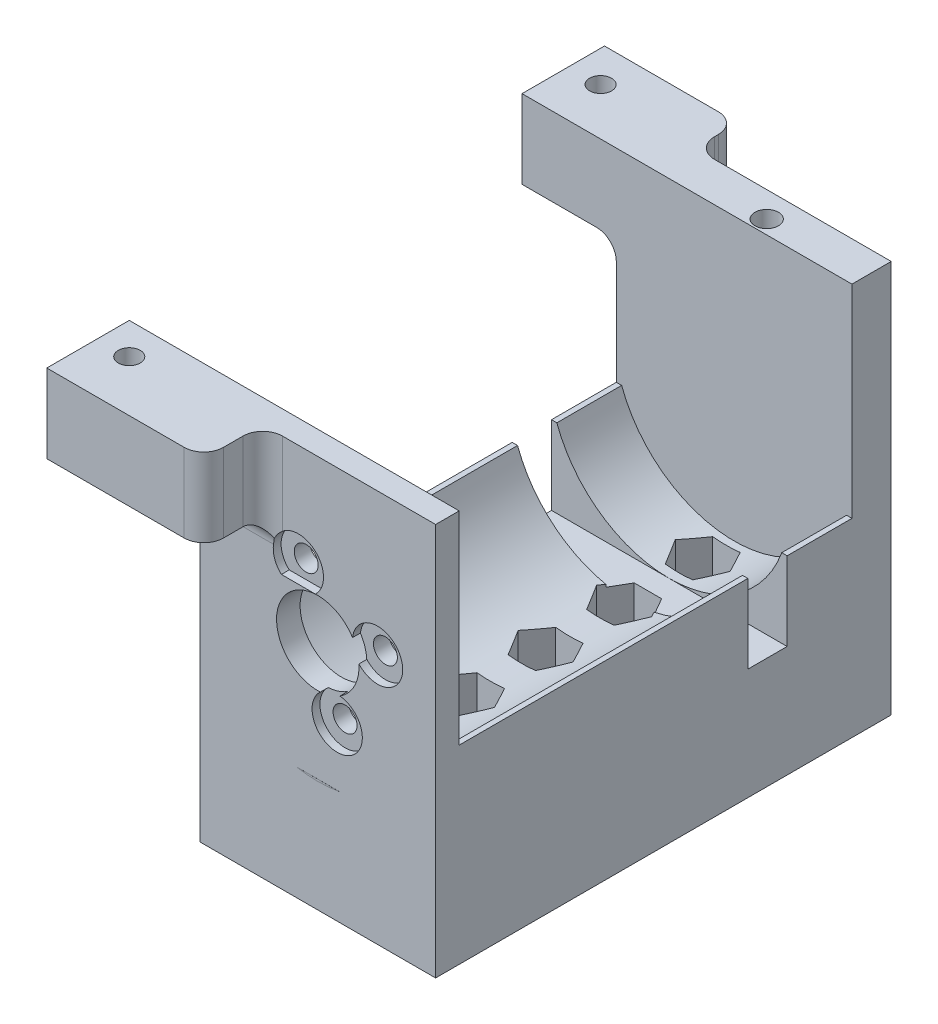
from build123d import *

# Parameters (mm, degrees)
SKETCH1_R            = 1.525
BOSS_EXTRUDE1_DEPTH  = 3
BOSS_EXTRUDE2_DEPTH  = 53
SKETCH3_R            = 1.55
CUT_EXTRUDE1_DEPTH   = 68.267232922
BOSS_EXTRUDE3_DEPTH  = 3
SKETCH7_W            = 30
SKETCH7_H            = 50
BOSS_EXTRUDE4_DEPTH  = 5
SKETCH9_W            = 5
SKETCH9_H            = 20
CUT_EXTRUDE6_DEPTH   = 70.215826448
SKETCH11_R           = 1.4
BOSS_EXTRUDE5_DEPTH  = 10
SKETCH12_R           = 1.5
CUT_EXTRUDE8_DEPTH   = 10
CUT_EXTRUDE2_START   = -5
SKETCH5_R            = 1.55
CUT_EXTRUDE2_DEPTH   = 79.00150601
SKETCH6_R            = 3.2
CUT_EXTRUDE3_DEPTH   = 1
BOSS_EXTRUDE8_REACH  = 85.002
SKETCH17_R           = 1.4
BOSS_EXTRUDE10_START = -3
BOSS_EXTRUDE10_DEPTH = 3
SKETCH20_W           = 22.007484123
SKETCH20_H           = 3
BOSS_EXTRUDE11_DEPTH = 7.575
FILLET3_R            = 2.5
FILLET2_R            = 2.5


with BuildPart() as part:
    # Sketch1 → Boss-Extrude1 (new body)
    with BuildSketch(Plane.XY):
        with BuildLine():
            Line((-15, -15), (15, -15))
            Line((15, -15), (15, 13))
            Line((15, 13), (-15, 13))
            Line((-15, 13), (-15, 5.25))
            Line((-15, 5.25), (0, 5.25))
            ThreePointArc((0, 5.25), (3.712310601, 3.712310601), (5.25, 0))
            ThreePointArc((5.25, 0), (3.712310601, -3.712310601), (0, -5.25))
            Line((0, -5.25), (-15, -5.25))
            Line((-15, -5.25), (-15, -15))
        make_face()
        with Locations((-2.472135955, 7.60845213)):
            Circle(SKETCH1_R, mode=Mode.SUBTRACT)
        with Locations((7.60845213, 2.472135955)):
            Circle(SKETCH1_R, mode=Mode.SUBTRACT)
        with Locations((2.472135955, -7.60845213)):
            Circle(SKETCH1_R, mode=Mode.SUBTRACT)
    extrude(amount=BOSS_EXTRUDE1_DEPTH)

    # Sketch2 → Boss-Extrude2 (add)
    with BuildSketch(Plane.XY.offset(3)):
        with BuildLine():
            Line((-15, -15), (-15, -5.25))
            Line((-15, -5.25), (-14.317821063, -5.25))
            ThreePointArc((-14.317821063, -5.25), (0, -15.25), (14.317821063, -5.25))
            Line((14.317821063, -5.25), (15, -5.25))
            Line((15, -5.25), (15, -15))
            Line((15, -15), (15, -29.425))
            Line((15, -29.425), (-15, -29.425))
            Line((-15, -29.425), (-15, -15))
        make_face()
    extrude(amount=-BOSS_EXTRUDE2_DEPTH)

    # Sketch3 → Cut-Extrude1 (cut, through all)
    with BuildSketch(Plane(origin=(0, -29.425, 0), x_dir=(-1, 0, 0), z_dir=(0, -1, 0))):
        with Locations(Location((0, 46, 0), (0, 0, 90))):
            Circle(SKETCH3_R)
        with Locations(Location((0, 36, 0), (0, 0, 90))):
            Circle(SKETCH3_R)
        with Locations(Location((0, 26, 0), (0, 0, 90))):
            Circle(SKETCH3_R)
        with Locations(Location((0, 16, 0), (0, 0, 90))):
            Circle(SKETCH3_R)
        with Locations(Location((0, 6, 0), (0, 0, 90))):
            Circle(SKETCH3_R)
    extrude(amount=-CUT_EXTRUDE1_DEPTH, mode=Mode.SUBTRACT)

    # Sketch7 → Boss-Extrude4 (add)
    with BuildSketch(Plane(origin=(0, 0, -50), x_dir=(-1, 0, 0), z_dir=(0, 0, -1))):
        with Locations((0, -4.425)):
            Rectangle(SKETCH7_W, SKETCH7_H)
    extrude(amount=BOSS_EXTRUDE4_DEPTH)

    # Sketch9 → Cut-Extrude6 (cut, through all)
    with BuildSketch(Plane.ZY.offset(15)):
        with Locations((-39.25, -5.25)):
            Rectangle(SKETCH9_W, SKETCH9_H)
    extrude(amount=-CUT_EXTRUDE6_DEPTH, mode=Mode.SUBTRACT)

    # Sketch11 → Boss-Extrude5 (add)
    with BuildSketch(Plane(origin=(0, 20.575, 0), x_dir=(1, 0, 0), z_dir=(0, 1, 0))):
        Polygon((-15, 50), (-27, 50), (-27, 60.5), (-10, 60.5), (-10, 55), (-15, 55), align=None)
        with Locations(Location((-23, 56, 0), (0, 0, 270))):
            Circle(SKETCH11_R, mode=Mode.SUBTRACT)
    extrude(amount=-BOSS_EXTRUDE5_DEPTH)

    # Sketch12 → Cut-Extrude8 (cut)
    with BuildSketch(Plane(origin=(0, 20.575, 0), x_dir=(1, 0, 0), z_dir=(0, 1, 0))):
        with Locations(Location((2.4, 51.75, 0), (0, 0, 270))):
            Circle(SKETCH12_R)
    extrude(amount=-CUT_EXTRUDE8_DEPTH, mode=Mode.SUBTRACT)

    # Sketch5 → Cut-Extrude2 (cut, through all)
    # profile 1 of 5: a face of its own
    with BuildSketch(Plane(origin=(0, -29.425, 0), x_dir=(-1, 0, 0), z_dir=(0, -1, 0)).offset(CUT_EXTRUDE2_START)):
        Polygon((1.746484564, 32.975), (3.492969129, 36), (1.746484564, 39.025), (-1.746484564, 39.025), (-3.492969129, 36), (-1.746484564, 32.975), align=None)
        with Locations(Location((0, 36, 0), (0, 0, 90))):
            Circle(SKETCH5_R, mode=Mode.SUBTRACT)
    # profile 2 of 5: a face of its own
    with BuildSketch(Plane(origin=(0, -29.425, 0), x_dir=(-1, 0, 0), z_dir=(0, -1, 0)).offset(CUT_EXTRUDE2_START)):
        Polygon((1.746484564, 42.975), (3.492969129, 46), (1.746484564, 49.025), (-1.746484564, 49.025), (-3.492969129, 46), (-1.746484564, 42.975), align=None)
        with Locations(Location((0, 46, 0), (0, 0, 90))):
            Circle(SKETCH5_R, mode=Mode.SUBTRACT)
    # profile 3 of 5: a face of its own
    with BuildSketch(Plane(origin=(0, -29.425, 0), x_dir=(-1, 0, 0), z_dir=(0, -1, 0)).offset(CUT_EXTRUDE2_START)):
        Polygon((1.746484564, 22.975), (3.492969129, 26), (1.746484564, 29.025), (-1.746484564, 29.025), (-3.492969129, 26), (-1.746484564, 22.975), align=None)
        with Locations(Location((0, 26, 0), (0, 0, 90))):
            Circle(SKETCH5_R, mode=Mode.SUBTRACT)
    # profile 4 of 5: a face of its own
    with BuildSketch(Plane(origin=(0, -29.425, 0), x_dir=(-1, 0, 0), z_dir=(0, -1, 0)).offset(CUT_EXTRUDE2_START)):
        Polygon((1.746484564, 12.975), (3.492969129, 16), (1.746484564, 19.025), (-1.746484564, 19.025), (-3.492969129, 16), (-1.746484564, 12.975), align=None)
        with Locations(Location((0, 16, 0), (0, 0, 90))):
            Circle(SKETCH5_R, mode=Mode.SUBTRACT)
    # profile 5 of 5: a face of its own
    with BuildSketch(Plane(origin=(0, -29.425, 0), x_dir=(-1, 0, 0), z_dir=(0, -1, 0)).offset(CUT_EXTRUDE2_START)):
        Polygon((1.746484564, 2.975), (3.492969129, 6), (1.746484564, 9.025), (-1.746484564, 9.025), (-3.492969129, 6), (-1.746484564, 2.975), align=None)
        with Locations(Location((0, 6, 0), (0, 0, 90))):
            Circle(SKETCH5_R, mode=Mode.SUBTRACT)
    extrude(amount=-CUT_EXTRUDE2_DEPTH, mode=Mode.SUBTRACT)

    # Sketch6 → Cut-Extrude3 (cut)
    with BuildSketch(Plane.XY.offset(3)):
        with Locations((2.472135955, -7.60845213)):
            Circle(SKETCH6_R)
        with Locations((-2.472135955, 7.60845213)):
            Circle(SKETCH6_R)
        with Locations((7.60845213, 2.472135955)):
            Circle(SKETCH6_R)
    extrude(amount=-CUT_EXTRUDE3_DEPTH, mode=Mode.SUBTRACT)

    # Boss-Extrude8: up to this face of the body (flat: up to its plane)
    boss_extrude8_end = Plane(part.part.faces().sort_by_distance((-19.329978932, 10.575, -55.685257093))[0])
    # Sketch17 → Boss-Extrude8 (add, up to the picked face)
    with BuildSketch(Plane(origin=(0, 20.575, 0), x_dir=(1, 0, 0), z_dir=(0, 1, 0)), mode=Mode.PRIVATE) as boss_extrude8_sk1:
        Polygon((-15, 0), (-27, 0), (-27, -10.5), (-7.007484123, -10.5), (-7.007484123, -3), (-7.007484123, 0), align=None)
        with Locations(Location((-23, -4, 0), (0, 0, 270))):
            Circle(SKETCH17_R, mode=Mode.SUBTRACT)
    boss_extrude8_tool1 = split(extrude(boss_extrude8_sk1.sketch, amount=-BOSS_EXTRUDE8_REACH, mode=Mode.PRIVATE), bisect_by=boss_extrude8_end, keep=Keep.BOTH, mode=Mode.PRIVATE)
    add(boss_extrude8_tool1.solids().sort_by(Axis((-16.822542, 20.575, 5.287774), (0, -1, 0)))[0])

    # Sketch19 → Boss-Extrude10 (add)
    with BuildSketch(Plane.XY.offset(3).offset(BOSS_EXTRUDE10_START)):
        with BuildLine():
            Line((-15, -5.25), (0, -5.25))
            ThreePointArc((0, -5.25), (-5.25, 0), (0, 5.25))
            Line((0, 5.25), (-15, 5.25))
            Line((-15, 5.25), (-15, -5.25))
        make_face()
    extrude(amount=BOSS_EXTRUDE10_DEPTH)

    # Sketch20 → Boss-Extrude11 (add)
    with BuildSketch(Plane(origin=(0, 13, 0), x_dir=(1, 0, 0), z_dir=(0, 1, 0))):
        with Locations((3.996257939, -1.5)):
            Rectangle(SKETCH20_W, SKETCH20_H)
    extrude(amount=BOSS_EXTRUDE11_DEPTH)

    # Fillet3
    # the kernel refuses this fillet: 2.5 mm, written as the material it adds along each edge
    with BuildSketch(Plane(origin=(-10, 20.575, -55), x_dir=(0, 0, -1), z_dir=(0, -1, 0)), Plane(origin=(-7.007484123, 20.575, 3), x_dir=(1, 0, 0), z_dir=(0, -1, 0))) as fillet3_piece_1:
        with BuildLine():
            CenterArc((FILLET3_R, FILLET3_R), FILLET3_R, 180, 90)
            Line((0, FILLET3_R), (-FILLET3_R * 0.02, FILLET3_R))
            Line((-FILLET3_R * 0.02, FILLET3_R), (-FILLET3_R * 0.02, -FILLET3_R * 0.02))
            Line((-FILLET3_R * 0.02, -FILLET3_R * 0.02), (FILLET3_R, -FILLET3_R * 0.02))
            Line((FILLET3_R, -FILLET3_R * 0.02), (FILLET3_R, 0))
        make_face()
    extrude(amount=10)
    with BuildSketch(Plane(origin=(-10, 10.575, -55), x_dir=(0, -1, 0), z_dir=(-1, 0, 0))) as fillet3_piece_2:
        with BuildLine():
            CenterArc((FILLET3_R, -FILLET3_R), FILLET3_R, 90, 90)
            Line((0, -FILLET3_R), (-FILLET3_R * 0.02, -FILLET3_R))
            Line((-FILLET3_R * 0.02, -FILLET3_R), (-FILLET3_R * 0.02, FILLET3_R * 0.02))
            Line((-FILLET3_R * 0.02, FILLET3_R * 0.02), (FILLET3_R, FILLET3_R * 0.02))
            Line((FILLET3_R, FILLET3_R * 0.02), (FILLET3_R, 0))
        make_face()
    extrude(amount=5)
    with BuildSketch(Plane(origin=(-15, 10.575, 3), x_dir=(-1, 0, 0), z_dir=(0, 0, -1))) as fillet3_piece_3:
        with BuildLine():
            CenterArc((FILLET3_R, -FILLET3_R), FILLET3_R, 90, 90)
            Line((0, -FILLET3_R), (-FILLET3_R * 0.02, -FILLET3_R))
            Line((-FILLET3_R * 0.02, -FILLET3_R), (-FILLET3_R * 0.02, FILLET3_R * 0.02))
            Line((-FILLET3_R * 0.02, FILLET3_R * 0.02), (FILLET3_R, FILLET3_R * 0.02))
            Line((FILLET3_R, FILLET3_R * 0.02), (FILLET3_R, 0))
        make_face()
    extrude(amount=3)
    with BuildSketch(Plane(origin=(-15, 10.575, 3), x_dir=(0, -1, 0), z_dir=(1, 0, 0))) as fillet3_piece_4:
        with BuildLine():
            CenterArc((FILLET3_R, -FILLET3_R), FILLET3_R, 90, 90)
            Line((0, -FILLET3_R), (-FILLET3_R * 0.02, -FILLET3_R))
            Line((-FILLET3_R * 0.02, -FILLET3_R), (-FILLET3_R * 0.02, FILLET3_R * 0.02))
            Line((-FILLET3_R * 0.02, FILLET3_R * 0.02), (FILLET3_R, FILLET3_R * 0.02))
            Line((FILLET3_R, FILLET3_R * 0.02), (FILLET3_R, 0))
        make_face()
    extrude(amount=7.992515877)
    with BuildSketch(Plane(origin=(-10, 20.575, -55), x_dir=(0, 0, -1), z_dir=(0, -1, 0))) as fillet3_piece_5a_section:
        with BuildLine():
            CenterArc((FILLET3_R, FILLET3_R), FILLET3_R, 180, 90)
            Line((0, FILLET3_R), (-FILLET3_R * 0.02, FILLET3_R))
            Line((-FILLET3_R * 0.02, FILLET3_R), (-FILLET3_R * 0.02, -FILLET3_R * 0.02))
            Line((-FILLET3_R * 0.02, -FILLET3_R * 0.02), (FILLET3_R, -FILLET3_R * 0.02))
            Line((FILLET3_R, -FILLET3_R * 0.02), (FILLET3_R, 0))
        make_face()
    fillet3_piece_5a = extrude(amount=12.5, mode=Mode.PRIVATE)
    fillet3_piece_5a = split(fillet3_piece_5a, bisect_by=Plane(origin=(-9.434012214, 10.575, -55.565987786), z_dir=(0, -1, 0)), keep=Keep.TOP, mode=Mode.PRIVATE)
    with BuildSketch(Plane(origin=(-7.5, 10.575, -55), x_dir=(0, -1, 0), z_dir=(-1, 0, 0))) as fillet3_piece_5b_section:
        with BuildLine():
            CenterArc((FILLET3_R, -FILLET3_R), FILLET3_R, 90, 90)
            Line((0, -FILLET3_R), (-FILLET3_R * 0.02, -FILLET3_R))
            Line((-FILLET3_R * 0.02, -FILLET3_R), (-FILLET3_R * 0.02, FILLET3_R * 0.02))
            Line((-FILLET3_R * 0.02, FILLET3_R * 0.02), (FILLET3_R, FILLET3_R * 0.02))
            Line((FILLET3_R, FILLET3_R * 0.02), (FILLET3_R, 0))
        make_face()
    fillet3_piece_5b = extrude(amount=7.5, mode=Mode.PRIVATE)
    fillet3_piece_5b = split(fillet3_piece_5b, bisect_by=Plane(origin=(-10, 10.009012214, -55.565987786), z_dir=(1, 0, 0)), keep=Keep.TOP, mode=Mode.PRIVATE)
    fillet3_piece_5 = fillet3_piece_5a & fillet3_piece_5b
    add(fillet3_piece_5)
    with BuildSketch(Plane(origin=(-17.5, 10.575, 3), x_dir=(0, -1, 0), z_dir=(1, 0, 0))) as fillet3_piece_6a_section:
        with BuildLine():
            CenterArc((FILLET3_R, -FILLET3_R), FILLET3_R, 90, 90)
            Line((0, -FILLET3_R), (-FILLET3_R * 0.02, -FILLET3_R))
            Line((-FILLET3_R * 0.02, -FILLET3_R), (-FILLET3_R * 0.02, FILLET3_R * 0.02))
            Line((-FILLET3_R * 0.02, FILLET3_R * 0.02), (FILLET3_R, FILLET3_R * 0.02))
            Line((FILLET3_R, FILLET3_R * 0.02), (FILLET3_R, 0))
        make_face()
    fillet3_piece_6a = extrude(amount=10.492515877, mode=Mode.PRIVATE)
    fillet3_piece_6a = split(fillet3_piece_6a, bisect_by=Plane(origin=(-15, 10.009012214, 3.565987786), z_dir=(-1, 0, 0)), keep=Keep.TOP, mode=Mode.PRIVATE)
    with BuildSketch(Plane(origin=(-15, 10.575, 5.5), x_dir=(-1, 0, 0), z_dir=(0, 0, -1))) as fillet3_piece_6b_section:
        with BuildLine():
            CenterArc((FILLET3_R, -FILLET3_R), FILLET3_R, 90, 90)
            Line((0, -FILLET3_R), (-FILLET3_R * 0.02, -FILLET3_R))
            Line((-FILLET3_R * 0.02, -FILLET3_R), (-FILLET3_R * 0.02, FILLET3_R * 0.02))
            Line((-FILLET3_R * 0.02, FILLET3_R * 0.02), (FILLET3_R, FILLET3_R * 0.02))
            Line((FILLET3_R, FILLET3_R * 0.02), (FILLET3_R, 0))
        make_face()
    fillet3_piece_6b = extrude(amount=5.5, mode=Mode.PRIVATE)
    fillet3_piece_6b = split(fillet3_piece_6b, bisect_by=Plane(origin=(-15.565987786, 10.009012214, 3), z_dir=(0, 0, 1)), keep=Keep.TOP, mode=Mode.PRIVATE)
    fillet3_piece_6 = fillet3_piece_6a & fillet3_piece_6b
    add(fillet3_piece_6)
    with BuildSketch(Plane(origin=(-7.007484123, 20.575, 3), x_dir=(1, 0, 0), z_dir=(0, -1, 0))) as fillet3_piece_7a_section:
        with BuildLine():
            CenterArc((FILLET3_R, FILLET3_R), FILLET3_R, 180, 90)
            Line((0, FILLET3_R), (-FILLET3_R * 0.02, FILLET3_R))
            Line((-FILLET3_R * 0.02, FILLET3_R), (-FILLET3_R * 0.02, -FILLET3_R * 0.02))
            Line((-FILLET3_R * 0.02, -FILLET3_R * 0.02), (FILLET3_R, -FILLET3_R * 0.02))
            Line((FILLET3_R, -FILLET3_R * 0.02), (FILLET3_R, 0))
        make_face()
    fillet3_piece_7a = extrude(amount=12.5, mode=Mode.PRIVATE)
    fillet3_piece_7a = fillet3_piece_7a - Plane(origin=(-2.472135955, 7.60845213, 3.588038551), x_dir=(1, 0, 0), z_dir=(0, 0, 1)) * Cylinder(3.2, 35, mode=Mode.PRIVATE)
    fillet3_piece_7a = split(fillet3_piece_7a, bisect_by=Plane(origin=(-6.495673783, 10.575, 3.588038551), z_dir=(0, -1, 0)), keep=Keep.TOP, mode=Mode.PRIVATE)
    with BuildSketch(Plane(origin=(-15, 10.575, 3), x_dir=(0, -1, 0), z_dir=(1, 0, 0))) as fillet3_piece_7b_section:
        with BuildLine():
            CenterArc((FILLET3_R, -FILLET3_R), FILLET3_R, 90, 90)
            Line((0, -FILLET3_R), (-FILLET3_R * 0.02, -FILLET3_R))
            Line((-FILLET3_R * 0.02, -FILLET3_R), (-FILLET3_R * 0.02, FILLET3_R * 0.02))
            Line((-FILLET3_R * 0.02, FILLET3_R * 0.02), (FILLET3_R, FILLET3_R * 0.02))
            Line((FILLET3_R, FILLET3_R * 0.02), (FILLET3_R, 0))
        make_face()
    fillet3_piece_7b = extrude(amount=10.492515877, mode=Mode.PRIVATE)
    fillet3_piece_7b = fillet3_piece_7b - Plane(origin=(-2.472135955, 7.60845213, 3.603544735), x_dir=(1, 0, 0), z_dir=(0, 0, 1)) * Cylinder(3.2, 31, mode=Mode.PRIVATE)
    fillet3_piece_7b = split(fillet3_piece_7b, bisect_by=Plane(origin=(-7.007484123, 10.078702119, 3.603544735), z_dir=(1, 0, 0)), keep=Keep.TOP, mode=Mode.PRIVATE)
    fillet3_piece_7 = fillet3_piece_7a & fillet3_piece_7b
    add(fillet3_piece_7)
    # the kernel refuses this fillet: 2.5 mm, written as the material it takes off along each edge
    with BuildSketch(Plane(origin=(-10, 23.075, -60.5), x_dir=(0, 0, 1), z_dir=(0, -1, 0)), Plane(origin=(-7.007484123, 23.075, 10.5), x_dir=(-1, 0, 0), z_dir=(0, -1, 0))) as fillet3_2_piece_1:
        with BuildLine():
            CenterArc((FILLET3_R, FILLET3_R), FILLET3_R, 180, 90)
            Line((0, FILLET3_R), (-FILLET3_R * 0.02, FILLET3_R))
            Line((-FILLET3_R * 0.02, FILLET3_R), (-FILLET3_R * 0.02, -FILLET3_R * 0.02))
            Line((-FILLET3_R * 0.02, -FILLET3_R * 0.02), (FILLET3_R, -FILLET3_R * 0.02))
            Line((FILLET3_R, -FILLET3_R * 0.02), (FILLET3_R, 0))
        make_face()
    extrude(amount=15, mode=Mode.SUBTRACT)

    # Fillet2
    fillet2_edges = [part.edges().sort_by_distance(p)[0] for p in [
        (-15, 10.575, -53.75),
    ]]
    fillet(fillet2_edges, radius=FILLET2_R)


with BuildPart() as body_2:
    # Sketch4 → Boss-Extrude3 (new body)
    with BuildSketch(Plane.XY.offset(3)):
        with BuildLine():
            Line((-2.75, -15), (2.693973064, -15.010163528))
            ThreePointArc((2.693973064, -15.010163528), (-0.028470664, -15.249973424), (-2.75, -15))
        make_face()
    extrude(amount=-BOSS_EXTRUDE3_DEPTH)


solid = Compound([part.part, body_2.part])
